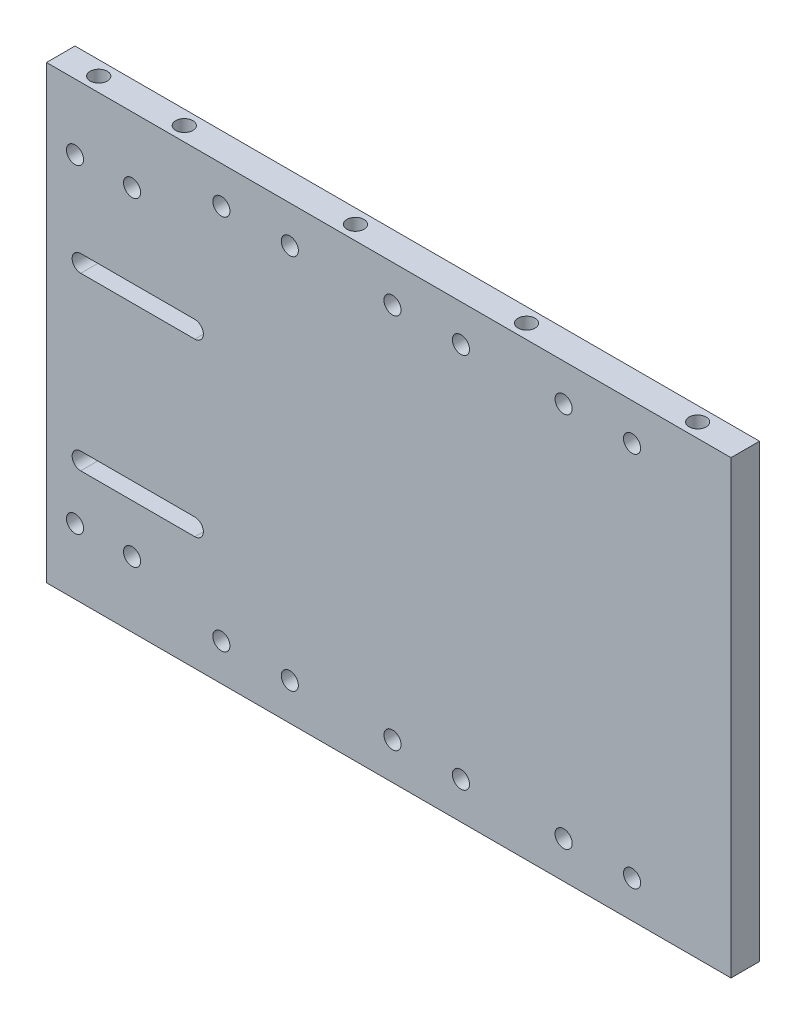
from build123d import *

# Parameters (mm, degrees)
SKETCH_1_W               = 120
SKETCH_1_H               = 79
EXTRUDE_1_DEPTH          = 5
SKETCH_2_R               = 3.1
CUT_EXTRUDE_1_DEPTH      = 1.5
SKETCH_3_R               = 1.5
CUT_EXTRUDE_2_DEPTH      = 72.920094549
PATTERN_LINEAR_1_COUNT   = 3
PATTERN_LINEAR_1_PITCH   = 30
MIRROR_2_COPY_1_SKETCH_R = 3.1
MIRROR_2_COPY_1_DEPTH    = 1.5
MIRROR_2_COPY_2_SKETCH_R = 3.1
MIRROR_2_COPY_2_DEPTH    = 1.5
MIRROR_2_COPY_3_SKETCH_R = 1.5
MIRROR_2_COPY_3_DEPTH    = 72.920094549
MIRROR_2_COPY_4_SKETCH_R = 1.5
MIRROR_2_COPY_4_DEPTH    = 72.920094549
MIRROR_2_COPY_5_SKETCH_R = 3.1
MIRROR_2_COPY_5_DEPTH    = 1.5
MIRROR_2_COPY_6_SKETCH_R = 1.5
MIRROR_2_COPY_6_DEPTH    = 72.920094549
CUT_EXTRUDE_3_DEPTH      = 1.5
CUT_EXTRUDE_4_DEPTH      = 72.920094549
SKETCH_6_R               = 1.5
CUT_EXTRUDE_5_DEPTH      = 73.008680032
SKETCH_7_R               = 1.5
CUT_EXTRUDE_6_DEPTH      = 5


with BuildPart() as part:
    # 草图1 → 凸台-拉伸1 (new body)
    with BuildSketch(Plane.XY):
        Rectangle(SKETCH_1_W, SKETCH_1_H)
    extrude(amount=EXTRUDE_1_DEPTH)

    # 草图2 → 切除-拉伸1 (cut)
    with BuildSketch(Plane(origin=(0, 0, 0), x_dir=(-1, 0, 0), z_dir=(0, 0, -1))):
        with Locations((-42.655984764, -33)):
            Circle(SKETCH_2_R)
        with Locations((-30.655984764, -33)):
            Circle(SKETCH_2_R)
    cut_extrude_1 = extrude(amount=-CUT_EXTRUDE_1_DEPTH, mode=Mode.SUBTRACT)

    # 草图3 → 切除-拉伸2 (cut, through all)
    with BuildSketch(Plane(origin=(0, 0, 1.5), x_dir=(-1, 0, 0), z_dir=(0, 0, -1))):
        with Locations((-42.655984764, -33)):
            Circle(SKETCH_3_R)
        with Locations((-30.655984764, -33)):
            Circle(SKETCH_3_R)
    cut_extrude_2 = extrude(amount=-CUT_EXTRUDE_2_DEPTH, mode=Mode.SUBTRACT)

    # 阵列(线性)1: 切除-拉伸1, 切除-拉伸2 ×3
    with Locations(*[(-i * PATTERN_LINEAR_1_PITCH, 0, 0) for i in range(1, PATTERN_LINEAR_1_COUNT)]):
        add(cut_extrude_1, mode=Mode.SUBTRACT)
        add(cut_extrude_2, mode=Mode.SUBTRACT)

    # 镜向2 copy 1 sketch → 镜向2 copy 1 (cut)
    with BuildSketch(Plane(origin=(-30, 0, 0), x_dir=(-1, 0, 0), z_dir=(0, 0, -1))):
        with Locations((-42.655984764, 33)):
            Circle(MIRROR_2_COPY_1_SKETCH_R)
        with Locations((-30.655984764, 33)):
            Circle(MIRROR_2_COPY_1_SKETCH_R)
    extrude(amount=-MIRROR_2_COPY_1_DEPTH, mode=Mode.SUBTRACT)

    # 镜向2 copy 2 sketch → 镜向2 copy 2 (cut)
    with BuildSketch(Plane(origin=(-60, 0, 0), x_dir=(-1, 0, 0), z_dir=(0, 0, -1))):
        with Locations((-42.655984764, 33)):
            Circle(MIRROR_2_COPY_2_SKETCH_R)
        with Locations((-30.655984764, 33)):
            Circle(MIRROR_2_COPY_2_SKETCH_R)
    extrude(amount=-MIRROR_2_COPY_2_DEPTH, mode=Mode.SUBTRACT)

    # 镜向2 copy 3 sketch → 镜向2 copy 3 (cut, through all)
    with BuildSketch(Plane(origin=(-30, 0, 1.5), x_dir=(-1, 0, 0), z_dir=(0, 0, -1))):
        with Locations((-42.655984764, 33)):
            Circle(MIRROR_2_COPY_3_SKETCH_R)
        with Locations((-30.655984764, 33)):
            Circle(MIRROR_2_COPY_3_SKETCH_R)
    extrude(amount=-MIRROR_2_COPY_3_DEPTH, mode=Mode.SUBTRACT)

    # 镜向2 copy 4 sketch → 镜向2 copy 4 (cut, through all)
    with BuildSketch(Plane(origin=(-60, 0, 1.5), x_dir=(-1, 0, 0), z_dir=(0, 0, -1))):
        with Locations((-42.655984764, 33)):
            Circle(MIRROR_2_COPY_4_SKETCH_R)
        with Locations((-30.655984764, 33)):
            Circle(MIRROR_2_COPY_4_SKETCH_R)
    extrude(amount=-MIRROR_2_COPY_4_DEPTH, mode=Mode.SUBTRACT)

    # 镜向2 copy 5 sketch → 镜向2 copy 5 (cut)
    with BuildSketch(Plane(origin=(0, 0, 0), x_dir=(-1, 0, 0), z_dir=(0, 0, -1))):
        with Locations((-42.655984764, 33)):
            Circle(MIRROR_2_COPY_5_SKETCH_R)
        with Locations((-30.655984764, 33)):
            Circle(MIRROR_2_COPY_5_SKETCH_R)
    extrude(amount=-MIRROR_2_COPY_5_DEPTH, mode=Mode.SUBTRACT)

    # 镜向2 copy 6 sketch → 镜向2 copy 6 (cut, through all)
    with BuildSketch(Plane(origin=(0, 0, 1.5), x_dir=(-1, 0, 0), z_dir=(0, 0, -1))):
        with Locations((-42.655984764, 33)):
            Circle(MIRROR_2_COPY_6_SKETCH_R)
        with Locations((-30.655984764, 33)):
            Circle(MIRROR_2_COPY_6_SKETCH_R)
    extrude(amount=-MIRROR_2_COPY_6_DEPTH, mode=Mode.SUBTRACT)

    # 草图4 → 切除-拉伸3 (cut)
    with BuildSketch(Plane(origin=(0, 0, 0), x_dir=(-1, 0, 0), z_dir=(0, 0, -1))):
        with BuildLine():
            Line((34, 15.1), (54, 15.1))
            ThreePointArc((54, 15.1), (57.1, 12), (54, 8.9))
            Line((54, 8.9), (34, 8.9))
            ThreePointArc((34, 8.9), (30.9, 12), (34, 15.1))
        make_face()
        with BuildLine():
            Line((34, -21.1), (54, -21.1))
            ThreePointArc((54, -21.1), (57.1, -18), (54, -14.9))
            Line((54, -14.9), (34, -14.9))
            ThreePointArc((34, -14.9), (30.9, -18), (34, -21.1))
        make_face()
    extrude(amount=-CUT_EXTRUDE_3_DEPTH, mode=Mode.SUBTRACT)

    # 草图5 → 切除-拉伸4 (cut, through all)
    with BuildSketch(Plane(origin=(0, 0, 1.5), x_dir=(-1, 0, 0), z_dir=(0, 0, -1))):
        with BuildLine():
            Line((54, 10.5), (34, 10.5))
            ThreePointArc((34, 10.5), (32.5, 12), (34, 13.5))
            Line((34, 13.5), (54, 13.5))
            ThreePointArc((54, 13.5), (55.5, 12), (54, 10.5))
        make_face()
        with BuildLine():
            Line((54, -16.5), (34, -16.5))
            ThreePointArc((34, -16.5), (32.5, -18), (34, -19.5))
            Line((34, -19.5), (54, -19.5))
            ThreePointArc((54, -19.5), (55.5, -18), (54, -16.5))
        make_face()
    extrude(amount=-CUT_EXTRUDE_4_DEPTH, mode=Mode.SUBTRACT)

    # 草图6 → 切除-拉伸5 (cut, through all)
    with BuildSketch(Plane.XY.offset(5)):
        with Locations((-45, 28)):
            Circle(SKETCH_6_R)
        with Locations((-55, 28)):
            Circle(SKETCH_6_R)
        with Locations((-55, -28)):
            Circle(SKETCH_6_R)
        with Locations((-45, -28)):
            Circle(SKETCH_6_R)
    extrude(amount=-CUT_EXTRUDE_5_DEPTH, mode=Mode.SUBTRACT)

    # 草图7 → 切除-拉伸6 (cut)
    with BuildSketch(Plane.XZ.offset(39.5)):
        with Locations((51.655984764, 2.5)):
            Circle(SKETCH_7_R)
        with Locations((21.655984764, 2.5)):
            Circle(SKETCH_7_R)
        with Locations((-8.344015236, 2.5)):
            Circle(SKETCH_7_R)
        with Locations((-38.344015236, 2.5)):
            Circle(SKETCH_7_R)
        with Locations((-53.344015236, 2.5)):
            Circle(SKETCH_7_R)
    cut_extrude_6 = extrude(amount=-CUT_EXTRUDE_6_DEPTH, mode=Mode.SUBTRACT)

    # 镜向3: 切除-拉伸6 across plane
    add(cut_extrude_6.mirror(Plane.ZX), mode=Mode.SUBTRACT)


solid = part.part
